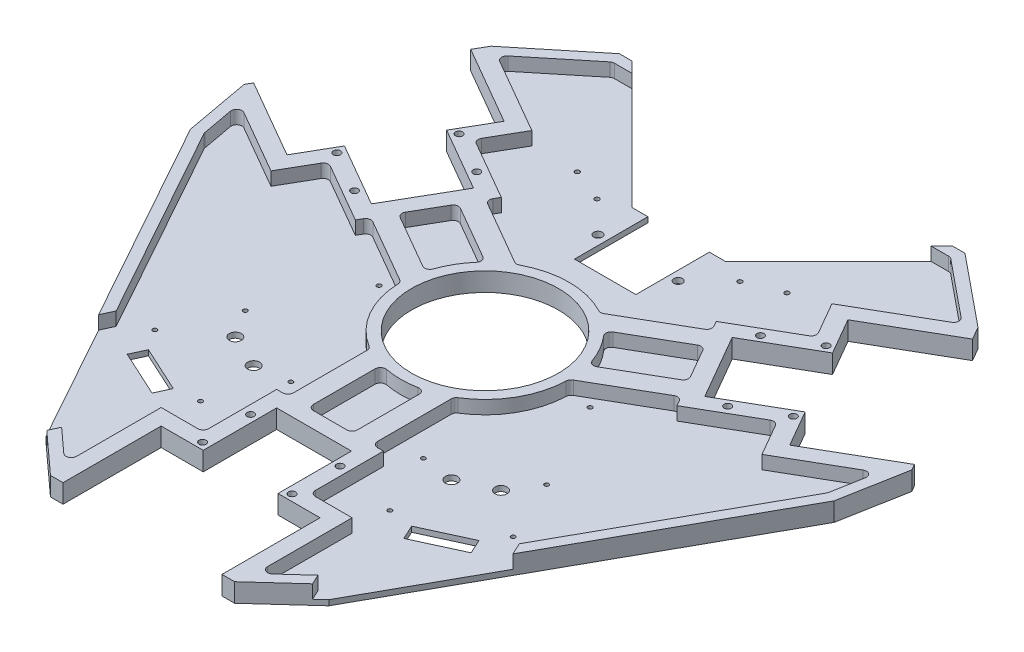
from build123d import *

# Parameters (mm, degrees)
SKETCH_1_R               = 55
EXTRUDE_1_DEPTH          = 4
CUT_EXTRUDE_7_DEPTH      = 359.179802853
SKETCH_36_R              = 55
EXTRUDE_4_DEPTH          = 10
HOLE_WIZARD_M5_1_D       = 5.3
PATTERN_CIRCULAR_5_COUNT = 3
CUT_EXTRUDE_START        = -4
CUT_EXTRUDE_2_DEPTH      = 14
SKETCH_7_W               = 46
SKETCH_7_H               = 140
CUT_EXTRUDE_4_DEPTH      = 359.297043209
HOLE_WIZARD_M6_1_D       = 6.4
HOLE_WIZARD_M4_1_D       = 3.3
HOLE_WIZARD_M3_1_D       = 3.2
CUT_EXTRUDE_8_REACH      = 360.297
HOLE_WIZARD_9_0_9_1_D    = 9
CUT_EXTRUDE_6_DEPTH      = 10
HOLE_WIZARD_M3_3_D       = 3.4
FILLET_1_R               = 4


# Read off the part's stored shape, not the designer's step: 切除-拉伸2
with BuildPart() as part:
    # 草图1 → 凸台-拉伸1 (new body)
    with BuildSketch(Plane(origin=(0, 0, 0), x_dir=(1, 0, 0), z_dir=(0, 1, 0))):
        Polygon((-182.311172983, 186.857532322), (-250, 69.617044824), (-240.989856922, 20.435571466), (-105.901782555, -222.823992729), (-68.915866776, -256.469825071), (68.915866776, -256.469825071), (105.901782555, -222.823992729), (240.989856922, 20.435571466), (250, 69.617044824), (182.311172983, 186.857532322), (129.416945427, 230), (-129.416945427, 230), align=None)
        with Locations(Location((0, 0, 0), (0, 0, 270))):
            Circle(SKETCH_1_R, mode=Mode.SUBTRACT)
    extrude(amount=EXTRUDE_1_DEPTH)

    # 草图34 → 切除-拉伸7 (cut, through all)
    with BuildSketch(Plane(origin=(0, 4, 0), x_dir=(1, 0, 0), z_dir=(0, 1, 0))):
        Polygon((-144.482648893, 115.748711306), (-128.732648893, 143.028511525), (-187.895064677, 177.185948204), (-247.395064677, 74.128925154), (-188.232648893, 39.971488475), (-172.482648893, 67.251288694), (-124.851251684, 39.751288694), (-96.851251684, 88.248711306), align=None)
        Polygon((172.482648893, 67.251288694), (188.232648893, 39.971488475), (247.395064677, 74.128925154), (187.895064677, 177.185948204), (128.732648893, 143.028511525), (144.482648893, 115.748711306), (96.851251684, 88.248711306), (124.851251684, 39.751288694), align=None)
        Polygon((-28, -183), (-59.5, -183), (-59.5, -256.469825071), (59.5, -256.469825071), (59.5, -183), (28, -183), (28, -128), (-28, -128), align=None)
    extrude(amount=-CUT_EXTRUDE_7_DEPTH, mode=Mode.SUBTRACT)

    # 草图36 → 凸台-拉伸4 (add)
    with BuildSketch(Plane(origin=(0, 4, 0), x_dir=(1, 0, 0), z_dir=(0, 1, 0))):
        Polygon((144.482648893, 115.748711306), (128.732648893, 143.028511525), (187.895064677, 177.185948204), (182.311172983, 186.857532322), (129.416945427, 230), (-129.416945427, 230), (-182.311172983, 186.857532322), (-187.895064677, 177.185948204), (-128.732648893, 143.028511525), (-144.482648893, 115.748711306), (-96.851251684, 88.248711306), (-124.851251684, 39.751288694), (-172.482648893, 67.251288694), (-188.232648893, 39.971488475), (-247.395064677, 74.128925154), (-250, 69.617044824), (-240.989856922, 20.435571466), (-105.901782555, -222.823992729), (-68.915866776, -256.469825071), (-59.5, -256.469825071), (-59.5, -183), (-28, -183), (-28, -128), (28, -128), (28, -183), (59.5, -183), (59.5, -256.469825071), (68.915866776, -256.469825071), (105.901782555, -222.823992729), (240.989856922, 20.435571466), (250, 69.617044824), (247.395064677, 74.128925154), (188.232648893, 39.971488475), (172.482648893, 67.251288694), (124.851251684, 39.751288694), (96.851251684, 88.248711306), align=None)
        with Locations(Location((0, 0, 0), (0, 0, 270))):
            Circle(SKETCH_36_R, mode=Mode.SUBTRACT)
        with BuildLine():
            Line((-63, 0), (-116.208946839, 30.720199781))
            Line((-116.208946839, 30.720199781), (-120.458946839, 23.358983849))
            Line((-120.458946839, 23.358983849), (-168.090344047, 50.858983849))
            Line((-168.090344047, 50.858983849), (-183.840344047, 23.579183629))
            Line((-183.840344047, 23.579183629), (-239.298536862, 55.59798618))
            Line((-239.298536862, 55.59798618), (-233.357708917, 23.170235722))
            Line((-233.357708917, 23.170235722), (-99.546044209, -217.790836477))
            Line((-99.546044209, -217.790836477), (-71.5, -243.304129347))
            Line((-71.5, -243.304129347), (-71.5, -171))
            Line((-71.5, -171), (-40, -171))
            Line((-40, -171), (-40, -116))
            Line((-40, -116), (-31.5, -116))
            Line((-31.5, -116), (-31.5, -54.559600438))
            ThreePointArc((-31.5, -54.559600438), (-54.559600438, -31.5), (-63, 0))
        make_face(mode=Mode.SUBTRACT)
        with BuildLine():
            Line((-31.5, 54.559600438), (-84.708946839, 85.279800219))
            Line((-84.708946839, 85.279800219), (-80.458946839, 92.641016151))
            Line((-80.458946839, 92.641016151), (-128.090344047, 120.141016151))
            Line((-128.090344047, 120.141016151), (-112.340344047, 147.420816371))
            Line((-112.340344047, 147.420816371), (-174.210187251, 183.141386999))
            Line((-174.210187251, 183.141386999), (-126.568120647, 222))
            Line((-126.568120647, 222), (126.568120647, 222))
            Line((126.568120647, 222), (174.210187251, 183.141386999))
            Line((174.210187251, 183.141386999), (112.340344047, 147.420816371))
            Line((112.340344047, 147.420816371), (128.090344047, 120.141016151))
            Line((128.090344047, 120.141016151), (80.458946839, 92.641016151))
            Line((80.458946839, 92.641016151), (84.708946839, 85.279800219))
            Line((84.708946839, 85.279800219), (31.5, 54.559600438))
            ThreePointArc((31.5, 54.559600438), (0, 63), (-31.5, 54.559600438))
        make_face(mode=Mode.SUBTRACT)
        with BuildLine():
            Line((-108.708946839, 43.710580838), (-60.905127955, 16.111033137))
            ThreePointArc((-60.905127955, 16.111033137), (-54.559600438, 31.5), (-44.405127955, 44.689871462))
            Line((-44.405127955, 44.689871462), (-92.208946839, 72.289419162))
            Line((-92.208946839, 72.289419162), (-108.708946839, 43.710580838))
        make_face(mode=Mode.SUBTRACT)
        with BuildLine():
            Line((92.208946839, 72.289419162), (44.405127955, 44.689871462))
            ThreePointArc((44.405127955, 44.689871462), (54.559600438, 31.5), (60.905127955, 16.111033137))
            Line((60.905127955, 16.111033137), (108.708946839, 43.710580838))
            Line((108.708946839, 43.710580838), (92.208946839, 72.289419162))
        make_face(mode=Mode.SUBTRACT)
        with BuildLine():
            Line((63, 0), (116.208946839, 30.720199781))
            Line((116.208946839, 30.720199781), (120.458946839, 23.358983849))
            Line((120.458946839, 23.358983849), (168.090344047, 50.858983849))
            Line((168.090344047, 50.858983849), (183.840344047, 23.579183629))
            Line((183.840344047, 23.579183629), (239.298536862, 55.59798618))
            Line((239.298536862, 55.59798618), (233.357708917, 23.170235722))
            Line((233.357708917, 23.170235722), (99.546044209, -217.790836477))
            Line((99.546044209, -217.790836477), (71.5, -243.304129347))
            Line((71.5, -243.304129347), (71.5, -171))
            Line((71.5, -171), (40, -171))
            Line((40, -171), (40, -116))
            Line((40, -116), (31.5, -116))
            Line((31.5, -116), (31.5, -54.559600438))
            ThreePointArc((31.5, -54.559600438), (54.559600438, -31.5), (63, 0))
        make_face(mode=Mode.SUBTRACT)
        with BuildLine():
            Line((16.5, -116), (16.5, -60.800904599))
            ThreePointArc((16.5, -60.800904599), (0, -63), (-16.5, -60.800904599))
            Line((-16.5, -60.800904599), (-16.5, -116))
            Line((-16.5, -116), (16.5, -116))
        make_face(mode=Mode.SUBTRACT)
    extrude(amount=EXTRUDE_4_DEPTH)

    # M5 间隙孔1 (through all)
    with Locations(Plane(origin=(0, 0, 0), x_dir=(-1, 0, 0), z_dir=(0, -1, 0))):
        with Locations((106.225607337, 100.011851027), (137.402521874, 118.011851027), (139.725607337, 41.988148973), (170.902521874, 59.988148973)):
            hole_wizard_m5_1 = Hole(HOLE_WIZARD_M5_1_D / 2)

    # 阵列(圆周)5: M5 间隙孔1 ×3 about axis
    pattern_circular_5_axis = Axis((0, 0, 0), (0, 1, 0))
    for i in range(1, PATTERN_CIRCULAR_5_COUNT):
        add(hole_wizard_m5_1.rotate(pattern_circular_5_axis, i * 360 / PATTERN_CIRCULAR_5_COUNT), mode=Mode.SUBTRACT)

    # 切除-拉伸2 outline → 切除-拉伸2 (cut)
    with BuildSketch(Plane(origin=(0, 4, 0), x_dir=(1, 0, 0), z_dir=(0, 1, 0)).offset(CUT_EXTRUDE_START)):
        Polygon((-35, 145), (35, 145), (120, 230), (-120, 230), align=None)
    extrude(amount=CUT_EXTRUDE_2_DEPTH, mode=Mode.SUBTRACT)

    # 草图7 → 切除-拉伸4 (cut, through all)
    with BuildSketch(Plane(origin=(0, 4, 0), x_dir=(1, 0, 0), z_dir=(0, 1, 0))):
        with Locations((0, 160)):
            Rectangle(SKETCH_7_W, SKETCH_7_H)
    extrude(amount=-CUT_EXTRUDE_4_DEPTH, mode=Mode.SUBTRACT)

    # M6 间隙孔1 (through all)
    with Locations(Plane(origin=(0, 4, 0), x_dir=(1, 0, 0), z_dir=(0, 1, 0))):
        with Locations((30, 114.64), (-30, 114.64)):
            Hole(HOLE_WIZARD_M6_1_D / 2)

    # 电磁铁M4 螺纹孔1 (through all)
    with Locations(Plane(origin=(0, 4, 0), x_dir=(1, 0, 0), z_dir=(0, 1, 0))):
        with Locations((-79, -0.36), (79, -0.36)):
            Hole(HOLE_WIZARD_M4_1_D / 2)

    # 电池座 M3 间隙孔1 (through all)
    with Locations(Plane(origin=(0, 0, 0), x_dir=(-1, 0, 0), z_dir=(0, -1, 0))):
        with Locations((-112.82328286, -66.701278411), (-70.91, -142.123004193), (-134.139212822, -113.033029186), (-49.594070038, -95.791253418)):
            hole_wizard_m3_1 = Hole(HOLE_WIZARD_M3_1_D / 2)

    # 草图37 → 切除-拉伸8 (cut, up to next)
    with BuildSketch(Plane(origin=(0, 4, 0), x_dir=(1, 0, 0), z_dir=(0, 1, 0)), mode=Mode.PRIVATE) as cut_extrude_8_sk1:
        Polygon((99.492826503, -228.654175821), (181.254739635, -191.037828828), (150.964351277, -125.19942878), (69.202438145, -162.815775772), align=None)
    cut_extrude_8_tool1 = extrude(cut_extrude_8_sk1.sketch, amount=CUT_EXTRUDE_8_REACH, mode=Mode.PRIVATE) & part.part
    cut_extrude_8 = cut_extrude_8_tool1.solids().sort_by_distance((125.228589, 4, 176.926802))[0]
    add(cut_extrude_8, mode=Mode.SUBTRACT)

    # Ø9.0 (9) 直径孔1 (through all)
    with Locations(Plane(origin=(0, 0, 0), x_dir=(-1, 0, 0), z_dir=(0, -1, 0))):
        with Locations((-99.486056436, -87.47742799), (-74.049016795, -99.180291498)):
            hole_wizard_9_0_9_1 = Hole(HOLE_WIZARD_9_0_9_1_D / 2)

    # 草图21 → 切除-拉伸6 (cut)
    with BuildSketch(Plane.XZ):
        Polygon((89.234372488, 144.149669663), (94.24988542, 155.05125808), (128.771582076, 139.168800461), (123.756069143, 128.267212044), align=None)
    cut_extrude_6 = extrude(amount=-CUT_EXTRUDE_6_DEPTH, mode=Mode.SUBTRACT)

    # M3 间隙孔3 (through all)
    with Locations(Plane(origin=(0, 0, 0), x_dir=(-1, 0, 0), z_dir=(0, -1, 0))):
        with Locations((53.517161568, 137.386324493), (78.508936531, 147.604503599)):
            hole_wizard_m3_3 = Hole(HOLE_WIZARD_M3_3_D / 2)

    # 镜向1: 电池座 M3 间隙孔1, 切除-拉伸8, Ø9.0 (9) 直径孔1, 切除-拉伸6, M3 间隙孔3 across plane
    add(hole_wizard_m3_1.mirror(Plane(origin=(0, 0, 0), x_dir=(0, 0, 1), z_dir=(1, 0, 0))), mode=Mode.SUBTRACT)
    add(cut_extrude_8.mirror(Plane(origin=(0, 0, 0), x_dir=(0, 0, 1), z_dir=(1, 0, 0))), mode=Mode.SUBTRACT)
    add(hole_wizard_9_0_9_1.mirror(Plane(origin=(0, 0, 0), x_dir=(0, 0, 1), z_dir=(1, 0, 0))), mode=Mode.SUBTRACT)
    add(cut_extrude_6.mirror(Plane(origin=(0, 0, 0), x_dir=(0, 0, 1), z_dir=(1, 0, 0))), mode=Mode.SUBTRACT)
    add(hole_wizard_m3_3.mirror(Plane(origin=(0, 0, 0), x_dir=(0, 0, 1), z_dir=(1, 0, 0))), mode=Mode.SUBTRACT)

    # 圆角1
    fillet_1_edges = [part.edges().sort_by_distance(p)[0] for p in [
        (-16.5, 9, 116),
        (-16.5, 9, 60.800904599),
        (-116.208946839, 9, -30.720199781),
        (-63, 9, 0),
        (-31.5, 9, 54.559600438),
        (-31.5, 9, 116),
        (-40, 9, 171),
        (-71.5, 9, 243.304129347),
        (-233.357708917, 9, -23.170235722),
        (-239.298536862, 9, -55.59798618),
        (-168.090344047, 9, -50.858983849),
        (-92.208946839, 9, -72.289419162),
        (-44.405127955, 9, -44.689871462),
        (-60.905127955, 9, -16.111033137),
        (-31.5, 9, -54.559600438),
        (-84.708946839, 9, -85.279800219),
        (-128.090344047, 9, -120.141016151),
        (-174.210187251, 9, -183.141386999),
        (-126.568120647, 9, -222),
        (-108.708946839, 9, -43.710580838),
    ]]
    fillet(fillet_1_edges, radius=FILLET_1_R)

    # 镜向3: part across plane


with BuildPart() as part_1:
    add(part.part)
    add(part.part.mirror(Plane(origin=(0, 0, 0), x_dir=(0, 0, 1), z_dir=(1, 0, 0))))


solid = part_1.part
